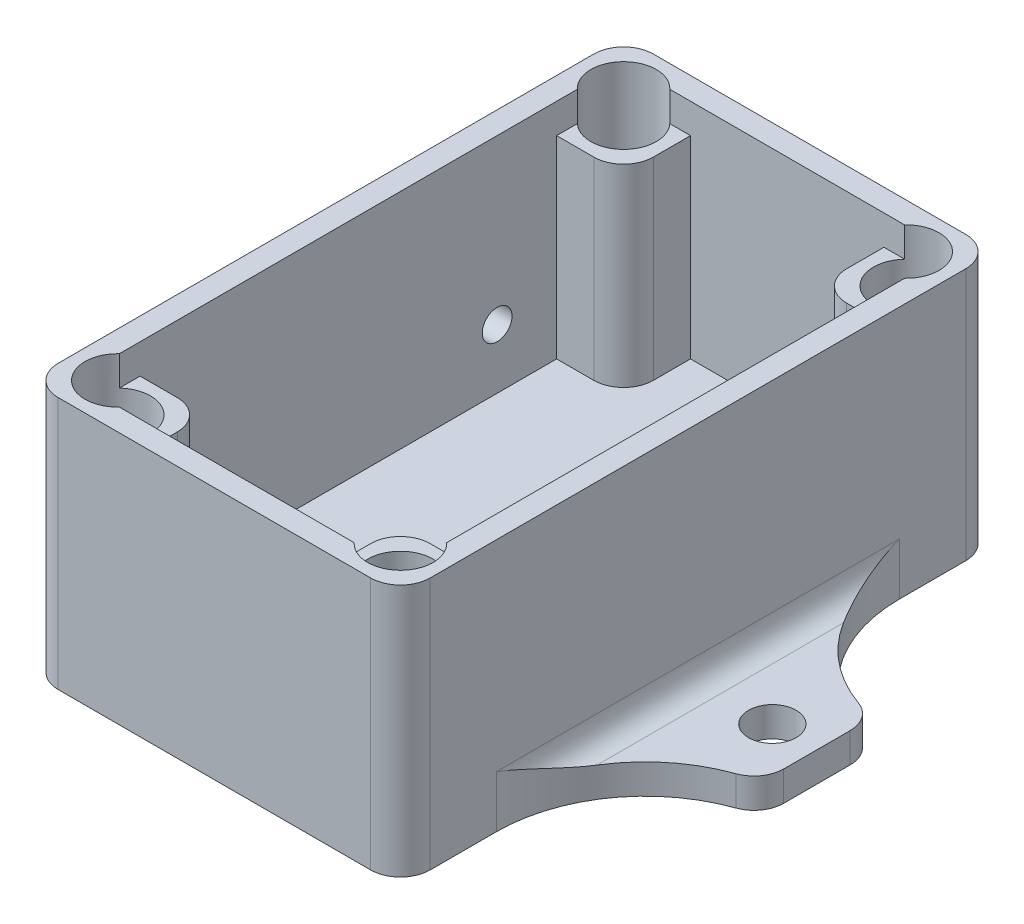
from build123d import *

# Parameters (mm, degrees)
BASE_DEPTH                  = 2
MUR_DEPTH                   = 15
ESQUISSE3_W                 = 4.5
ESQUISSE3_H                 = 4.5
FIXATION_VIS_DEPTH          = 13
CONG_1_R                    = 2
ESQUISSE4_R                 = 2.2
INSERT_M3_DEPTH             = 6
INSERT_M3_DIRECTION_2_REACH = 29.951
PASSE_CABLE_REACH           = 38.249
ESQUISSE5_R                 = 1
ESQUISSE8_W                 = 8
ESQUISSE8_H                 = 7.5
PATES_FIXATION_DEPTH        = 2
PASSAGE_VIS_REACH           = 34.33
ESQUISSE9_R                 = 1.6
CONG_10MM_R                 = 10
CONG_2MM_R                  = 2
CONG_1_5MM_R                = 1.5


with BuildPart() as part:
    # Esquisse1 → Base (new body)
    with BuildSketch(Plane(origin=(0, 0, 0), x_dir=(1, 0, 0), z_dir=(0, 1, 0))):
        with BuildLine():
            Line((-10.5, 20), (10.5, 20))
            ThreePointArc((10.5, 20), (11.914213562, 19.414213562), (12.5, 18))
            Line((12.5, 18), (12.5, -18))
            ThreePointArc((12.5, -18), (11.914213562, -19.414213562), (10.5, -20))
            Line((10.5, -20), (-10.5, -20))
            ThreePointArc((-10.5, -20), (-11.914213562, -19.414213562), (-12.5, -18))
            Line((-12.5, -18), (-12.5, 18))
            ThreePointArc((-12.5, 18), (-11.914213562, 19.414213562), (-10.5, 20))
        make_face()
    extrude(amount=BASE_DEPTH)

    # Esquisse2 → Mur (add)
    with BuildSketch(Plane(origin=(0, 2, 0), x_dir=(1, 0, 0), z_dir=(0, 1, 0))):
        with BuildLine():
            Line((-12.5, 18), (-12.5, -18))
            ThreePointArc((-12.5, -18), (-11.914213562, -19.414213562), (-10.5, -20))
            Line((-10.5, -20), (10.5, -20))
            ThreePointArc((10.5, -20), (11.914213562, -19.414213562), (12.5, -18))
            Line((12.5, -18), (12.5, 18))
            ThreePointArc((12.5, 18), (11.914213562, 19.414213562), (10.5, 20))
            Line((10.5, 20), (-10.5, 20))
            ThreePointArc((-10.5, 20), (-11.914213562, 19.414213562), (-12.5, 18))
        make_face()
        with BuildLine():
            ThreePointArc((-10.5, 18.5), (-10.853553391, 18.353553391), (-11, 18))
            Line((-11, 18), (-11, -18))
            ThreePointArc((-11, -18), (-10.853553391, -18.353553391), (-10.5, -18.5))
            Line((-10.5, -18.5), (10.5, -18.5))
            ThreePointArc((10.5, -18.5), (10.853553391, -18.353553391), (11, -18))
            Line((11, -18), (11, 18))
            ThreePointArc((11, 18), (10.853553391, 18.353553391), (10.5, 18.5))
            Line((10.5, 18.5), (-10.5, 18.5))
        make_face(mode=Mode.SUBTRACT)
    extrude(amount=MUR_DEPTH)

    # Esquisse3 → Fixation Vis (add)
    with BuildSketch(Plane(origin=(0, 2, 0), x_dir=(1, 0, 0), z_dir=(0, 1, 0))):
        with Locations((-8.75, 16.25)):
            Rectangle(ESQUISSE3_W, ESQUISSE3_H)
        with Locations((8.75, 16.25)):
            Rectangle(ESQUISSE3_W, ESQUISSE3_H)
        with Locations((8.75, -16.25)):
            Rectangle(ESQUISSE3_W, ESQUISSE3_H)
        with Locations((-8.75, -16.25)):
            Rectangle(ESQUISSE3_W, ESQUISSE3_H)
    extrude(amount=FIXATION_VIS_DEPTH)

    # Congé1
    cong_1_edges = [part.edges().sort_by_distance(p)[0] for p in [
        (6.5, 8.5, 14),
        (-6.5, 8.5, 14),
        (-6.5, 8.5, -14),
        (6.5, 8.5, -14),
    ]]
    fillet(cong_1_edges, radius=CONG_1_R)

    # Esquisse4 → Insert M3 (cut)
    with BuildSketch(Plane(origin=(0, 15, 0), x_dir=(1, 0, 0), z_dir=(0, 1, 0))):
        with Locations(Location((-9.5, 17, 0), (0, 0, 42.98588608))):
            Circle(ESQUISSE4_R)
        with Locations(Location((9.5, 17, 0), (0, 0, 90))):
            Circle(ESQUISSE4_R)
        with Locations(Location((9.5, -17, 0), (0, 0, 47.01411392))):
            Circle(ESQUISSE4_R)
        with Locations(Location((-9.5, -17, 0), (0, 0, 90))):
            Circle(ESQUISSE4_R)
    extrude(amount=-INSERT_M3_DEPTH, mode=Mode.SUBTRACT)

    # Esquisse4 → Insert M3 direction 2 (cut, up to next)
    with BuildSketch(Plane(origin=(0, 15, 0), x_dir=(1, 0, 0), z_dir=(0, 1, 0)), mode=Mode.PRIVATE) as insert_m3_direction_2_sk1:
        with Locations(Location((-9.5, 17, 0), (0, 0, 42.98588608))):
            Circle(ESQUISSE4_R)
    insert_m3_direction_2_tool1 = extrude(insert_m3_direction_2_sk1.sketch, amount=INSERT_M3_DIRECTION_2_REACH, mode=Mode.PRIVATE) & part.part
    # Esquisse4 → Insert M3 direction 2 (cut, up to next)
    with BuildSketch(Plane(origin=(0, 15, 0), x_dir=(1, 0, 0), z_dir=(0, 1, 0)), mode=Mode.PRIVATE) as insert_m3_direction_2_sk2:
        with Locations(Location((9.5, 17, 0), (0, 0, 90))):
            Circle(ESQUISSE4_R)
    insert_m3_direction_2_tool2 = extrude(insert_m3_direction_2_sk2.sketch, amount=INSERT_M3_DIRECTION_2_REACH, mode=Mode.PRIVATE) & part.part
    # Esquisse4 → Insert M3 direction 2 (cut, up to next)
    with BuildSketch(Plane(origin=(0, 15, 0), x_dir=(1, 0, 0), z_dir=(0, 1, 0)), mode=Mode.PRIVATE) as insert_m3_direction_2_sk3:
        with Locations(Location((9.5, -17, 0), (0, 0, 47.01411392))):
            Circle(ESQUISSE4_R)
    insert_m3_direction_2_tool3 = extrude(insert_m3_direction_2_sk3.sketch, amount=INSERT_M3_DIRECTION_2_REACH, mode=Mode.PRIVATE) & part.part
    # Esquisse4 → Insert M3 direction 2 (cut, up to next)
    with BuildSketch(Plane(origin=(0, 15, 0), x_dir=(1, 0, 0), z_dir=(0, 1, 0)), mode=Mode.PRIVATE) as insert_m3_direction_2_sk4:
        with Locations(Location((-9.5, -17, 0), (0, 0, 90))):
            Circle(ESQUISSE4_R)
    insert_m3_direction_2_tool4 = extrude(insert_m3_direction_2_sk4.sketch, amount=INSERT_M3_DIRECTION_2_REACH, mode=Mode.PRIVATE) & part.part
    add(insert_m3_direction_2_tool1.solids().sort_by_distance((-9.5, 15, -17))[0], mode=Mode.SUBTRACT)
    add(insert_m3_direction_2_tool2.solids().sort_by_distance((9.5, 15, -17))[0], mode=Mode.SUBTRACT)
    add(insert_m3_direction_2_tool3.solids().sort_by_distance((9.5, 15, 17))[0], mode=Mode.SUBTRACT)
    add(insert_m3_direction_2_tool4.solids().sort_by_distance((-9.5, 15, 17))[0], mode=Mode.SUBTRACT)

    # Esquisse5 → Passe-Cable (cut, up to next)
    with BuildSketch(Plane.ZY.offset(12.5), mode=Mode.PRIVATE) as passe_cable_sk1:
        with Locations((-10, 6)):
            Circle(ESQUISSE5_R)
    passe_cable_tool1 = extrude(passe_cable_sk1.sketch, amount=-PASSE_CABLE_REACH, mode=Mode.PRIVATE) & part.part
    add(passe_cable_tool1.solids().sort_by_distance((-12.5, 6, -10))[0], mode=Mode.SUBTRACT)

    # Esquisse8 → Pates fixation (add)
    with BuildSketch(Plane(origin=(0, 0, 0), x_dir=(1, 0, 0), z_dir=(0, 1, 0))):
        with Locations((16.5, 0)):
            Rectangle(ESQUISSE8_W, ESQUISSE8_H)
        with Locations((-16.5, 0)):
            Rectangle(ESQUISSE8_W, ESQUISSE8_H)
    extrude(amount=PATES_FIXATION_DEPTH)

    # Esquisse9 → Passage_Vis (cut, up to next)
    with BuildSketch(Plane(origin=(0, 2, 0), x_dir=(1, 0, 0), z_dir=(0, 1, 0)), mode=Mode.PRIVATE) as passage_vis_sk1:
        with Locations(Location((-17.5, 0, 0), (0, 0, 270))):
            Circle(ESQUISSE9_R)
    passage_vis_tool1 = extrude(passage_vis_sk1.sketch, amount=-PASSAGE_VIS_REACH, mode=Mode.PRIVATE) & part.part
    # Esquisse9 → Passage_Vis (cut, up to next)
    with BuildSketch(Plane(origin=(0, 2, 0), x_dir=(1, 0, 0), z_dir=(0, 1, 0)), mode=Mode.PRIVATE) as passage_vis_sk2:
        with Locations(Location((17.5, 0, 0), (0, 0, 270))):
            Circle(ESQUISSE9_R)
    passage_vis_tool2 = extrude(passage_vis_sk2.sketch, amount=-PASSAGE_VIS_REACH, mode=Mode.PRIVATE) & part.part
    add(passage_vis_tool1.solids().sort_by_distance((-17.5, 2, 0))[0], mode=Mode.SUBTRACT)
    add(passage_vis_tool2.solids().sort_by_distance((17.5, 2, 0))[0], mode=Mode.SUBTRACT)

    # Congé_10mm
    # the kernel refuses this fillet: 10 mm, written as the material it adds along each edge
    with BuildSketch(Plane(origin=(12.5, 0, 3.75), x_dir=(0, 0, 1), z_dir=(0, 1, 0)), Plane(origin=(-12.5, 0, -3.75), x_dir=(0, 0, -1), z_dir=(0, 1, 0))) as cong_10mm_piece_1:
        with BuildLine():
            CenterArc((9.797958971, 10), CONG_10MM_R, 191.536959033, 78.463040967)
            Line((0, 8), (-0.195959179, 7.96))
            ThreePointArc((-0.195959179, 7.96), (-0.2, 4), (-0.2, 0))
            Line((-0.2, 0), (0, -0.2))
            Line((0, -0.2), (9.797958971, -0.2))
            Line((9.797958971, -0.2), (9.797958971, 0))
        make_face()
    extrude(amount=2)
    with BuildSketch(Plane(origin=(12.5, 0, -3.75), x_dir=(0, 0, -1), z_dir=(0, 1, 0)), Plane(origin=(-12.5, 0, 3.75), x_dir=(0, 0, 1), z_dir=(0, 1, 0))) as cong_10mm_piece_2:
        with BuildLine():
            CenterArc((9.797958971, -10), CONG_10MM_R, 90, 78.463040967)
            Line((0, -8), (-0.195959179, -7.96))
            ThreePointArc((-0.195959179, -7.96), (-0.2, -4), (-0.2, 0))
            Line((-0.2, 0), (0, 0.2))
            Line((0, 0.2), (9.797958971, 0.2))
            Line((9.797958971, 0.2), (9.797958971, 0))
        make_face()
    extrude(amount=2)

    # Congé_2mm
    # the kernel refuses this fillet: 2 mm, written as the material it takes off along each edge
    with BuildSketch(Plane(origin=(20.5, -3.78937382, 3.75), x_dir=(-0.9636113749942804, 0, 0.26730716036356444), z_dir=(0, 1, 0)), Plane(origin=(-20.5, -3.78937382, -3.75), x_dir=(0.9636113749942804, 0, -0.26730716036356456), z_dir=(0, 1, 0))) as cong_2mm_piece_1:
        with BuildLine():
            CenterArc((1.522052048, -1.995207807), CONG_2MM_R, 93.967130801, 70.528779366)
            Line((-0.405170702, -1.460593487), (0, 0))
            ThreePointArc((0, 0), (0.69184184, -0.023960963), (1.38368368, 0))
        make_face()
    extrude(amount=9.578747639, mode=Mode.SUBTRACT)
    with BuildSketch(Plane(origin=(20.5, -3.78937382, -3.75), x_dir=(-0.9636113749942801, 0, -0.2673071603635657), z_dir=(0, 1, 0))) as cong_2mm_piece_2:
        with BuildLine():
            CenterArc((1.522052048, 1.995207807), CONG_2MM_R, 195.504089834, 70.528779366)
            Line((-0.405170702, 1.460593487), (0, 0))
            ThreePointArc((0, 0), (0.69184184, 0.023960963), (1.38368368, 0))
        make_face()
    extrude(amount=9.578747639, mode=Mode.SUBTRACT)
    with BuildSketch(Plane(origin=(-20.5, -3.78937382, 3.75), x_dir=(0, 0, -1), z_dir=(0, 1, 0))) as cong_2mm_piece_3:
        with BuildLine():
            CenterArc((1.515749528, -2), CONG_2MM_R, 90, 70.528779366)
            ThreePointArc((-0.369868555, -1.333333333), (-0.161845221, -0.673071604), (0, 0))
            Line((0, 0), (1.515749528, 0))
        make_face()
    extrude(amount=9.578747639, mode=Mode.SUBTRACT)

    # Congé_1,5mm
    cong_1_5mm_edges = [part.edges().sort_by_distance(p)[0] for p in [
        (12.5, 2, 0),
        (-12.5, 2, 0),
    ]]
    fillet(cong_1_5mm_edges, radius=CONG_1_5MM_R)


solid = part.part
